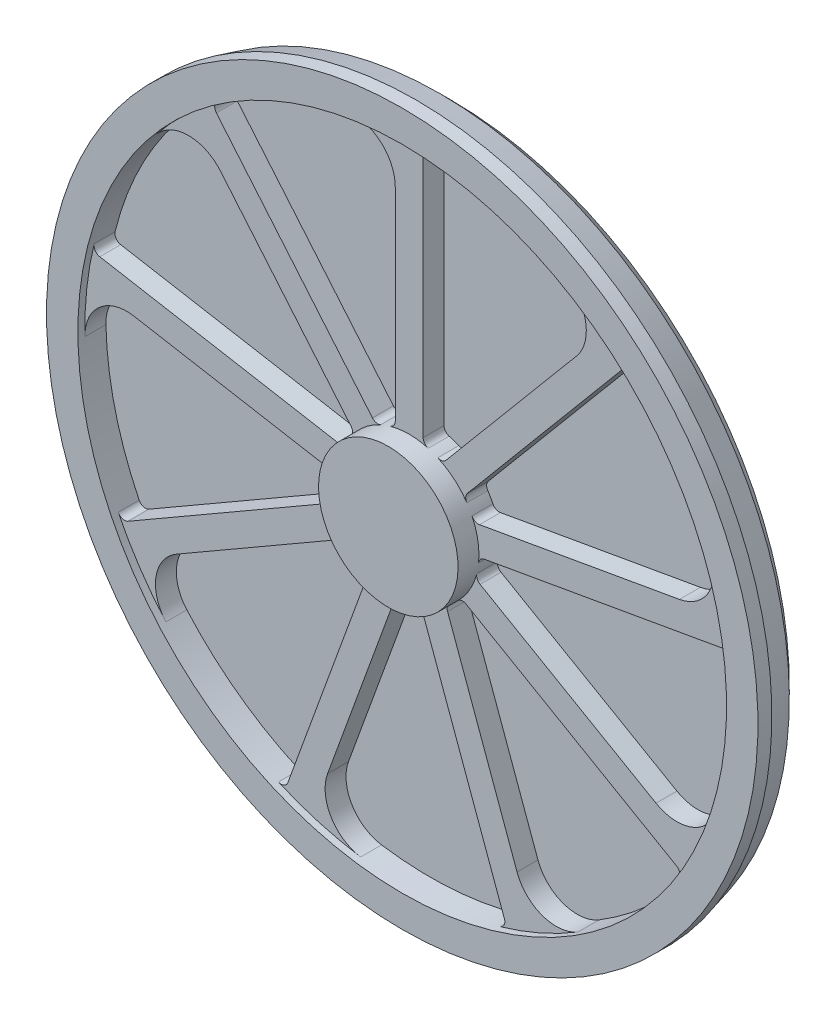
from build123d import *

# Parameters (mm, degrees)
BOSS_EXTRUDE1_DEPTH      = 30
FILLET1_R                = 60
FILLET2_R                = 10
CIRPATTERN1_COUNT        = 9
FILLET1_OF_CIRPATTERN1_R = 60
FILLET2_OF_CIRPATTERN1_R = 10


with BuildPart() as part:
    # Sketch1 → Revolve1 (revolve)
    with BuildSketch(Plane(origin=(0, 0, 0), x_dir=(0, 0, -1), z_dir=(1, 0, 0))):
        Polygon((0, 0), (0, 485), (-15.849364905, 500.849364905), (-50, 510), (-70, 510), (-70, 465), (-30, 465), (-30, 100), (-90, 100), (-90, 0), (-30, 0), align=None)
    revolve(axis=Axis((0, 0, 0), (0, 0, 1)))

    # Sketch2 → Boss-Extrude1 (add)
    with BuildSketch(Plane.XY.offset(30)):
        with BuildLine():
            Line((-20, 464.569693372), (-20, 97.979589711))
            ThreePointArc((-20, 97.979589711), (0, 100), (20, 97.979589711))
            Line((20, 97.979589711), (20, 464.569693372))
            ThreePointArc((20, 464.569693372), (0, 465), (-20, 464.569693372))
        make_face()
    boss_extrude1 = extrude(amount=BOSS_EXTRUDE1_DEPTH)

    # Fillet1
    fillet1_edges = [part.edges().sort_by_distance(p)[0] for p in [
        (-20, 464.569693372, 45),
    ]]
    fillet(fillet1_edges, radius=FILLET1_R)

    # Fillet2
    fillet2_edges = [part.edges().sort_by_distance(p)[0] for p in [
        (-20, 97.979589711, 45),
        (20, 97.979589711, 45),
        (20, 464.569693372, 45),
    ]]
    fillet(fillet2_edges, radius=FILLET2_R)

    # CirPattern1: Boss-Extrude1 ×9 about axis
    cirpattern1_axis = Axis((0, 0, 70), (0, 0, -1))
    for i in range(1, CIRPATTERN1_COUNT):
        add(boss_extrude1.rotate(cirpattern1_axis, i * 360 / CIRPATTERN1_COUNT))

    # Fillet1 of CirPattern1
    fillet1_of_cirpattern1_edges = [part.edges().sort_by_distance(p)[0] for p in [
        (283.298753873, 368.736784243, 45),
        (454.038872294, 100.367835714, 45),
        (412.329156289, -214.96433861, 45),
        (177.686045528, -429.712309836, 45),
        (-140.098340696, -443.393115569, 45),
        (-392.329156289, -249.605354762, 45),
        (-460.984799401, 60.975525593, 45),
        (-313.940531598, 343.025279856, 45),
    ]]
    fillet(fillet1_of_cirpattern1_edges, radius=FILLET1_OF_CIRPATTERN1_R)

    # Fillet2 of CirPattern1
    fillet2_of_cirpattern1_edges = [part.edges().sort_by_distance(p)[0] for p in [
        (47.659177406, 87.912472431, 45),
        (78.300955131, 62.200968044, 45),
        (313.940531598, 343.025279856, 45),
        (93.018096031, 36.710132262, 45),
        (99.964023138, -2.682177858, 45),
        (460.984799401, 60.975525593, 45),
        (94.852813742, -31.66928678, 45),
        (74.852813742, -66.310302931, 45),
        (392.329156289, -249.605354762, 45),
        (52.304845732, -85.230294573, 45),
        (14.7171409, -98.911100306, 45),
        (140.098340696, -443.393115569, 45),
        (-14.7171409, -98.911100306, 45),
        (-52.304845732, -85.230294573, 45),
        (-177.686045528, -429.712309836, 45),
        (-74.852813742, -66.310302931, 45),
        (-94.852813742, -31.66928678, 45),
        (-412.329156289, -214.96433861, 45),
        (-99.964023138, -2.682177858, 45),
        (-93.018096031, 36.710132262, 45),
        (-454.038872294, 100.367835714, 45),
        (-78.300955131, 62.200968044, 45),
        (-47.659177406, 87.912472431, 45),
        (-283.298753873, 368.736784243, 45),
    ]]
    fillet(fillet2_of_cirpattern1_edges, radius=FILLET2_OF_CIRPATTERN1_R)


solid = part.part
